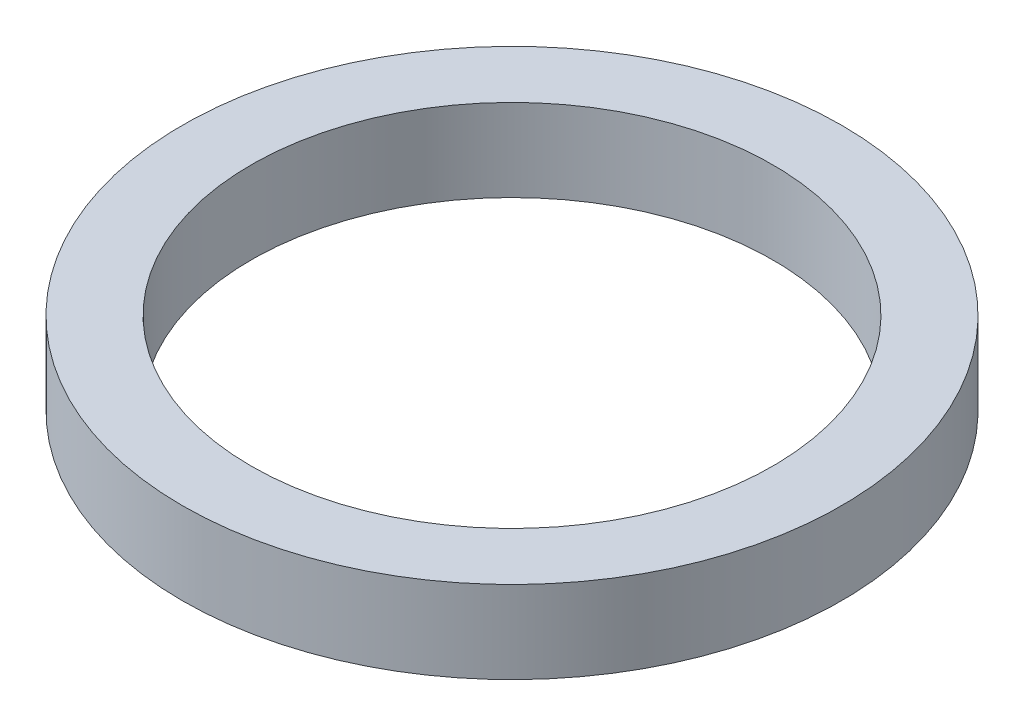
from build123d import *

# Parameters (mm, degrees)
SKETCH1_R           = 60
BOSS_EXTRUDE1_DEPTH = 15
SKETCH2_R           = 47.5
CUT_EXTRUDE1_DEPTH  = 87.168439698


with BuildPart() as part:
    # Sketch1 → Boss-Extrude1 (new body)
    with BuildSketch(Plane(origin=(0, 0, 0), x_dir=(1, 0, 0), z_dir=(0, 1, 0))):
        Circle(SKETCH1_R)
    extrude(amount=BOSS_EXTRUDE1_DEPTH)

    # Sketch2 → Cut-Extrude1 (cut, through all)
    with BuildSketch(Plane(origin=(0, 0, 0), x_dir=(1, 0, 0), z_dir=(0, 1, 0))):
        Circle(SKETCH2_R)
    extrude(amount=CUT_EXTRUDE1_DEPTH, mode=Mode.SUBTRACT)


solid = part.part
